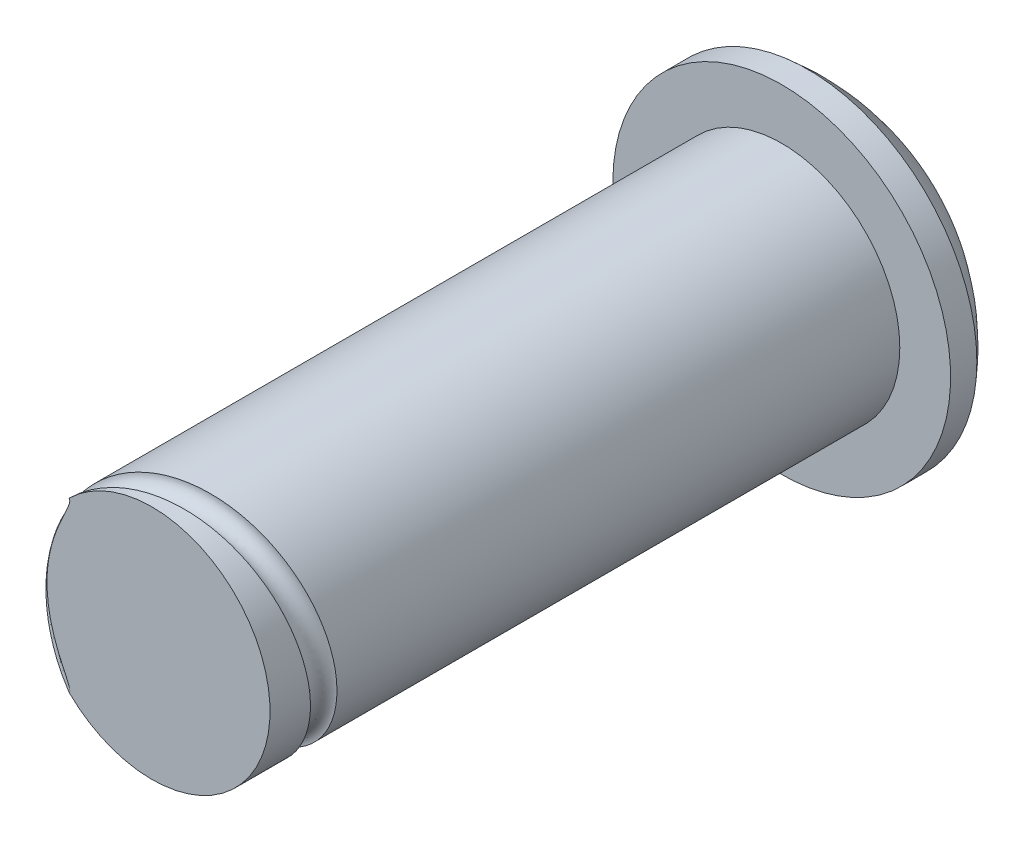
from build123d import *

# Parameters (mm, degrees)
SKETCH1_R           = 45
BOSS_EXTRUDE1_DEPTH = 240
SKETCH2_R           = 64.360130449
BOSS_EXTRUDE2_DEPTH = 10
DOME1_FACE_RADIUS   = 64.360130449
DOME1_HEIGHT        = 30
CUT_SWEEP2_PITCH    = 40


with BuildPart() as part:
    # Sketch1 → Boss-Extrude1 (new body)
    with BuildSketch(Plane.XY):
        Circle(SKETCH1_R)
    extrude(amount=BOSS_EXTRUDE1_DEPTH)

    # Sketch2 → Boss-Extrude2 (add)
    with BuildSketch(Plane(origin=(0, 0, 0), x_dir=(-1, 0, 0), z_dir=(0, 0, -1))):
        Circle(SKETCH2_R)
    extrude(amount=BOSS_EXTRUDE2_DEPTH)

    # Dome1: a dome of height H over a round flat face of radius A is a cap of a sphere of radius (A * A + H * H) / (2 * H)
    dome1_r = (DOME1_FACE_RADIUS * DOME1_FACE_RADIUS + DOME1_HEIGHT * DOME1_HEIGHT) / (2 * DOME1_HEIGHT)
    dome1_base = Plane((0, 0, -10), z_dir=(0, 0, -1))
    with Locations(dome1_base.offset(DOME1_HEIGHT - dome1_r)):
        dome1_ball = Sphere(dome1_r, mode=Mode.PRIVATE)
    add(split(dome1_ball, bisect_by=dome1_base, keep=Keep.TOP, mode=Mode.PRIVATE))

    # Cut-Sweep2: arcs per turn and ends read off the stored shape
    # Cut-Sweep2: the profile of Cut-Sweep2 profile screwed along a right-hand helix through 2 turns, 26 arcs to a turn; built about Z, then put on its axis
    cut_sweep2_z = Axis((0, 0, 0), (0, 0, 1))
    cut_sweep2_corners = [(45, 0.700381287, -44.950703592), (40, 0, -40), (45, -0.700381287, -35.049296408), (50, 0, -40)]
    with BuildLine(mode=Mode.PRIVATE) as cut_sweep2_profile:
        ThreePointArc((45, 0.700381287, -44.950703592), (41.464466094, 0.495244358, -43.500676081), (40, 0, -40))
        ThreePointArc((40, 0, -40), (41.464466094, -0.495244358, -36.499323919), (45, -0.700381287, -35.049296408))
        ThreePointArc((45, -0.700381287, -35.049296408), (48.535533906, -0.495244358, -36.499323919), (50, 0, -40))
        ThreePointArc((50, 0, -40), (48.535533906, 0.495244358, -43.500676081), (45, 0.700381287, -44.950703592))
    cut_sweep2_cap = Face(cut_sweep2_profile.wire())
    cut_sweep2_arcs = [((45, 0.700381287, -44.950703592), (40, 0.700381287, -44.950703592), (40, 0, -40), (1, 0.7071067811865476, 1)), ((40, 0, -40), (40, -0.700381287, -35.049296408), (45, -0.700381287, -35.049296408), (1, 0.7071067811865476, 1)), ((45, -0.700381287, -35.049296408), (50, -0.700381287, -35.049296408), (50, 0, -40), (1, 0.7071067811865476, 1)), ((50, 0, -40), (50, 0.700381287, -44.950703592), (45, 0.700381287, -44.950703592), (1, 0.7071067811865476, 1))]  # start, shoulder, end, weights
    cut_sweep2_turn_angles = [0, 6.923076923, 13.846153846, 20.769230769, 27.692307692, 34.615384615, 41.538461538, 48.461538462, 55.384615385, 62.307692308, 69.230769231, 76.153846154, 83.076923077, 90, 96.923076923, 103.846153846, 110.769230769, 117.692307692, 124.615384615, 131.538461538, 138.461538462, 145.384615385, 152.307692308, 159.230769231, 166.153846154, 173.076923077, 180, 186.923076923, 193.846153846, 200.769230769, 207.692307692, 214.615384615, 221.538461538, 228.461538462, 235.384615385, 242.307692308, 249.230769231, 256.153846154, 263.076923077, 270, 276.923076923, 283.846153846, 290.769230769, 297.692307692, 304.615384615, 311.538461538, 318.461538462, 325.384615385, 332.307692308, 339.230769231, 346.153846154, 353.076923077, 360]
    cut_sweep2_turn_weights = [1, 0.992708874098054, 1, 0.992708874098054, 1, 0.992708874098054, 1, 0.992708874098054, 1, 0.992708874098054, 1, 0.992708874098054, 1, 0.992708874098054, 1, 0.992708874098054, 1, 0.992708874098054, 1, 0.992708874098054, 1, 0.992708874098054, 1, 0.992708874098054, 1, 0.992708874098054, 1, 0.992708874098054, 1, 0.992708874098054, 1, 0.992708874098054, 1, 0.992708874098054, 1, 0.992708874098054, 1, 0.992708874098054, 1, 0.9927088740980541, 1, 0.992708874098054, 1, 0.992708874098054, 1, 0.9927088740980541, 1, 0.992708874098054, 1, 0.992708874098054, 1, 0.9927088740980541, 1]
    cut_sweep2_turn_sides = [Face.make_bezier_surface([[Vector(p[j][0], p[j][1], 0).rotate(cut_sweep2_z, cut_sweep2_turn_angles[2 * i + k]) / cut_sweep2_turn_weights[2 * i + k] + Vector(0, 0, p[j][2] + CUT_SWEEP2_PITCH * cut_sweep2_turn_angles[2 * i + k] / 360) for k in range(3)] for j in range(3)], [[p[3][j] * cut_sweep2_turn_weights[2 * i + k] for k in range(3)] for j in range(3)]) for p in cut_sweep2_arcs for i in range(26)]
    cut_sweep2 = Plane(origin=(0, 0, 240), x_dir=(-1, 0, 0), z_dir=(0, 0, -1)) * Solid(Shell([*[p.moved(Location((0, 0, CUT_SWEEP2_PITCH * i))) for i in range(2) for p in cut_sweep2_turn_sides], cut_sweep2_cap, cut_sweep2_cap.rotate(cut_sweep2_z, 720).moved(Location((0, 0, CUT_SWEEP2_PITCH * 720 / 360)))]))
    add(cut_sweep2, mode=Mode.SUBTRACT)


solid = part.part
